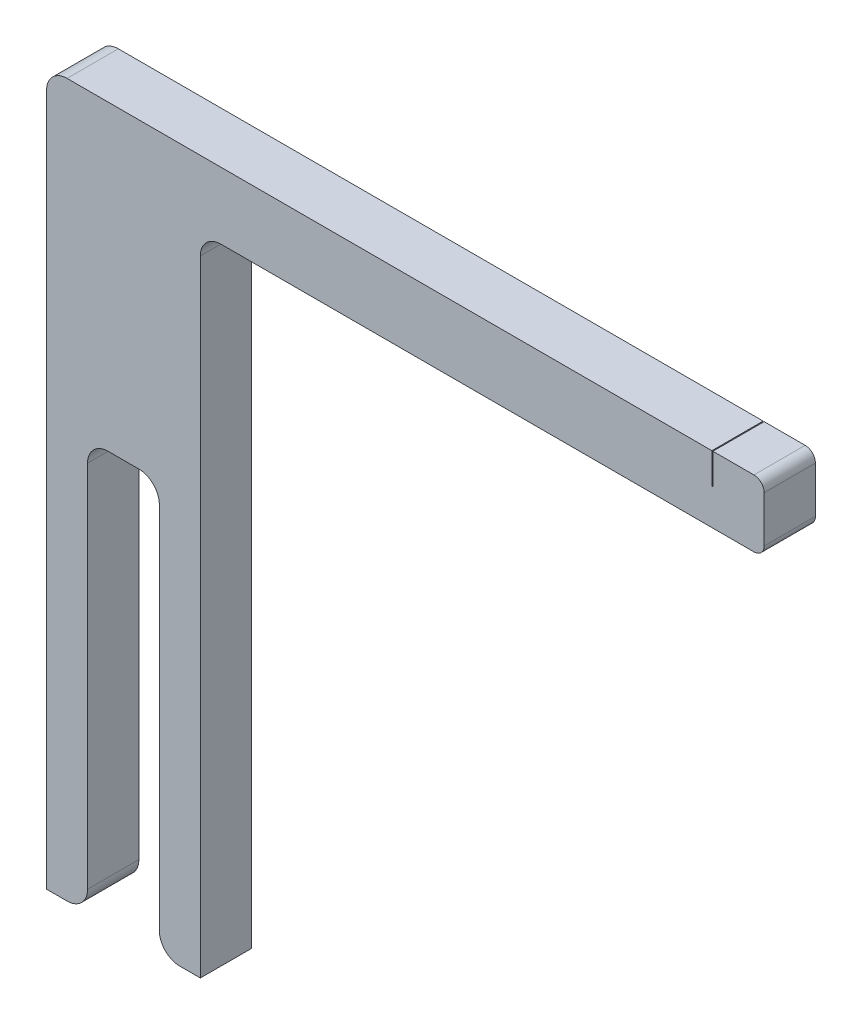
from build123d import *

# Parameters (mm, degrees)
BOSS_EXTRUDE1_DEPTH = 5
SKETCH3_W           = 0.1
SKETCH3_H           = 5
CUT_EXTRUDE1_DEPTH  = 3
FILLET1_R           = 2


with BuildPart() as part:
    # Sketch1 → Boss-Extrude1 (new body)
    with BuildSketch(Plane.XY):
        with BuildLine():
            Line((0, 0), (0, 67.5))
            ThreePointArc((0, 67.5), (0.585786438, 68.914213562), (2, 69.5))
            Line((2, 69.5), (69, 69.5))
            ThreePointArc((69, 69.5), (69.707106781, 69.207106781), (70, 68.5))
            Line((70, 68.5), (70, 64))
            ThreePointArc((70, 64), (69.707106781, 63.292893219), (69, 63))
            Line((69, 63), (17, 63))
            ThreePointArc((17, 63), (15.585786438, 62.414213562), (15, 61))
            Line((15, 61), (15, 0))
            Line((15, 0), (11, 0))
            Line((11, 0), (11, 40))
            Line((11, 40), (4, 40))
            Line((4, 40), (4, 0))
            Line((4, 0), (0, 0))
        make_face()
    extrude(amount=BOSS_EXTRUDE1_DEPTH)

    # Sketch3 → Cut-Extrude1 (cut)
    with BuildSketch(Plane(origin=(0, 69.5, 0), x_dir=(1, 0, 0), z_dir=(0, 1, 0))):
        with Locations((64.95, -2.5)):
            Rectangle(SKETCH3_W, SKETCH3_H)
    extrude(amount=-CUT_EXTRUDE1_DEPTH, mode=Mode.SUBTRACT)

    # Fillet1
    fillet1_edges = [part.edges().sort_by_distance(p)[0] for p in [
        (11, 0, 2.5),
        (4, 0, 2.5),
        (11, 40, 2.5),
        (4, 40, 2.5),
    ]]
    fillet(fillet1_edges, radius=FILLET1_R)


solid = part.part
